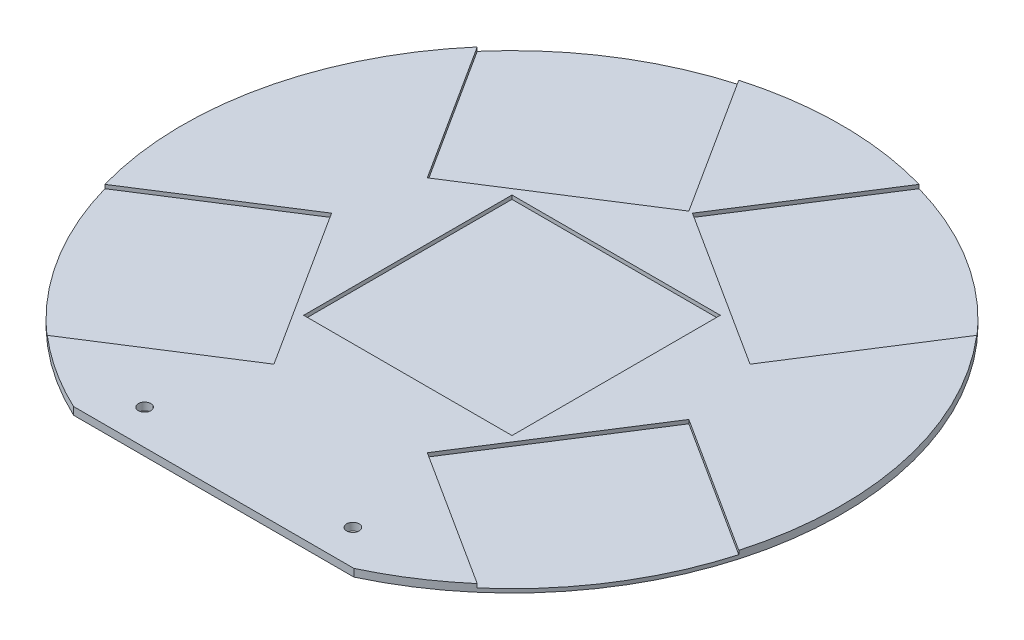
from build123d import *

# Parameters (mm, degrees)
RESSALTO_EXTRUS_O1_DEPTH = 2
ESBO_O3_W                = 55
ESBO_O3_H                = 55
CORTE_EXTRUS_O1_DEPTH    = 1
CORTE_EXTRUS_O2_DEPTH    = 1
ESPELHAR1_START          = 1
ESPELHAR1_DEPTH          = 1
ESBO_O5_R                = 1.65
CORTE_EXTRUS_O3_DEPTH    = 2


# Read off the part's stored shape, not the designer's step: Espelhar1
with BuildPart() as part:
    # Esboço2 → Ressalto-extrusão1 (new body)
    with BuildSketch(Plane(origin=(0, 0, 0), x_dir=(1, 0, 0), z_dir=(0, 1, 0))):
        with BuildLine():
            Line((-37, -78.74007874), (37, -78.74007874))
            ThreePointArc((37, -78.74007874), (0, 87), (-37, -78.74007874))
        make_face()
    extrude(amount=RESSALTO_EXTRUS_O1_DEPTH)

    # Esboço3 → Corte-extrusão1 (cut)
    with BuildSketch(Plane(origin=(0, 2, 0), x_dir=(1, 0, 0), z_dir=(0, 1, 0))):
        Rectangle(ESBO_O3_W, ESBO_O3_H)
    extrude(amount=-CORTE_EXTRUS_O1_DEPTH, mode=Mode.SUBTRACT)

    # Esboço4 → Corte-extrusão2 (cut)
    with BuildSketch(Plane(origin=(0, 2, 0), x_dir=(1, 0, 0), z_dir=(0, 1, 0))):
        Polygon((-0.472209327, 47.167542), (-42.60471375, 20.244465077), (-69.527790673, 62.376969501), (-27.39528625, 89.300046424), align=None)
        Polygon((-20.244465077, -42.60471375), (-47.167542, -0.472209327), (-89.300046424, -27.39528625), (-62.376969501, -69.527790673), align=None)
    extrude(amount=-CORTE_EXTRUS_O2_DEPTH, mode=Mode.SUBTRACT)

    # Espelhar1 outline → Espelhar1 (cut)
    with BuildSketch(Plane(origin=(0, 0, 0), x_dir=(1, 0, 0), z_dir=(0, 1, 0)).offset(ESPELHAR1_START)):
        with BuildLine():
            Line((42.60471375, 20.244465077), (65.936611163, 56.757055141))
            ThreePointArc((65.936611163, 56.757055141), (46.846153846, 73.310557697), (23.80410674, 83.680132064))
            Line((23.80410674, 83.680132064), (0.472209327, 47.167542))
            Line((0.472209327, 47.167542), (42.60471375, 20.244465077))
        make_face()
        with BuildLine():
            ThreePointArc((56.757055141, -65.936611163), (73.310557697, -46.846153846), (83.680132064, -23.80410674))
            Line((83.680132064, -23.80410674), (47.167542, -0.472209327))
            Line((47.167542, -0.472209327), (20.244465077, -42.60471375))
            Line((20.244465077, -42.60471375), (56.757055141, -65.936611163))
        make_face()
    extrude(amount=ESPELHAR1_DEPTH, mode=Mode.SUBTRACT)

    # Esboço5 → Corte-extrusão3 (cut)
    with BuildSketch(Plane(origin=(0, 2, 0), x_dir=(1, 0, 0), z_dir=(0, 1, 0))):
        with Locations(Location((-27.5, -69.5, 0), (0, 0, 270))):
            Circle(ESBO_O5_R)
        with Locations(Location((27.5, -69.5, 0), (0, 0, 270))):
            Circle(ESBO_O5_R)
    extrude(amount=-CORTE_EXTRUS_O3_DEPTH, mode=Mode.SUBTRACT)


solid = part.part
